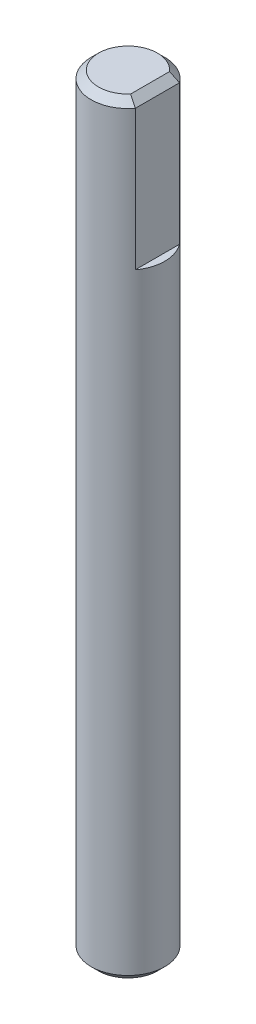
from build123d import *

# Parameters (mm, degrees)
SKETCH1_R           = 2.5
BOSS_EXTRUDE1_DEPTH = 26
CUT_EXTRUDE1_START  = 2
SKETCH2_W           = 13.97289477
SKETCH2_H           = 14.193433712
CUT_EXTRUDE1_DEPTH  = 52
CHAMFER1_SIZE       = 0.5


with BuildPart() as part:
    # Sketch1 → Boss-Extrude1 (new, symmetric)
    with BuildSketch(Plane(origin=(0, 0, 0), x_dir=(1, 0, 0), z_dir=(0, 1, 0))):
        with Locations(Location((0, 0, 0), (0, 0, 90))):
            Circle(SKETCH1_R)
    extrude(amount=BOSS_EXTRUDE1_DEPTH, both=True)

    # Sketch2 → Cut-Extrude1 (cut)
    with BuildSketch(Plane(origin=(0, 0, 0), x_dir=(0, 0, -1), z_dir=(1, 0, 0)).offset(CUT_EXTRUDE1_START)):
        with Locations((0, 23.096716856)):
            Rectangle(SKETCH2_W, SKETCH2_H)
    extrude(amount=CUT_EXTRUDE1_DEPTH, mode=Mode.SUBTRACT)

    # Chamfer1
    chamfer1_edges = [part.edges().sort_by_distance(p)[0] for p in [
        (0, -26, 2.5),
        (-2.236067977, 26, 1.118033989),
        (2, 26, 0),
    ]]
    chamfer(chamfer1_edges, length=CHAMFER1_SIZE - 0.0001)  # a hair under: the kernel refuses the full size


solid = part.part
